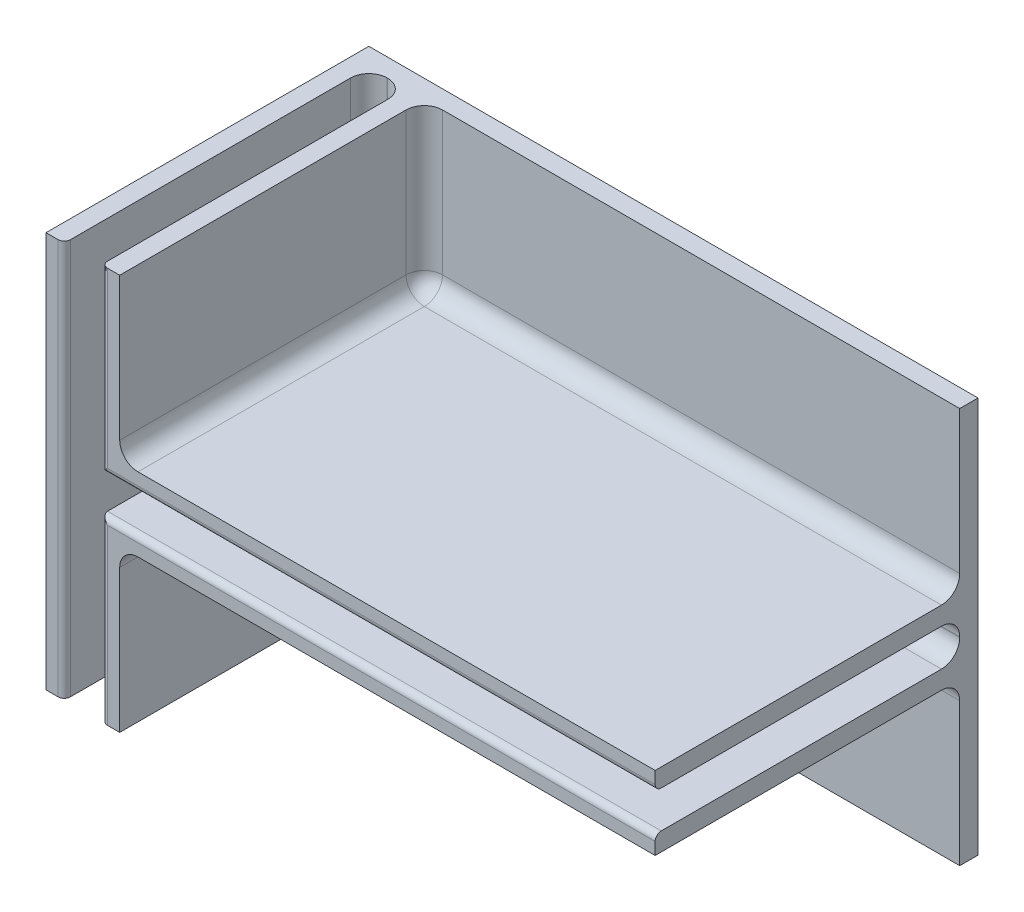
from build123d import *

# Parameters (mm, degrees)
SKETCH1_W           = 100
SKETCH1_H           = 65
BOSS_EXTRUDE1_DEPTH = 3
SKETCH2_W           = 3
SKETCH2_H           = 65
BOSS_EXTRUDE2_DEPTH = 50
FILLET2_R           = 3
FILLET3_R           = 1


with BuildPart() as part:
    # Sketch1 → Boss-Extrude1 (new body)
    with BuildSketch(Plane.XY):
        with Locations((50, 32.5)):
            Rectangle(SKETCH1_W, SKETCH1_H)
    extrude(amount=BOSS_EXTRUDE1_DEPTH)

    # Sketch2 → Boss-Extrude2 (add)
    with BuildSketch(Plane.XY.offset(3)):
        Polygon((9.1, 65), (9.1, 35.55), (100, 35.55), (100, 38.55), (12.1, 38.55), (12.1, 65), align=None)
        with Locations((1.5, 32.5)):
            Rectangle(SKETCH2_W, SKETCH2_H)
        Polygon((9.1, 0), (9.1, 29.45), (100, 29.45), (100, 26.45), (12.1, 26.45), (12.1, 0), align=None)
    extrude(amount=BOSS_EXTRUDE2_DEPTH)

    # Fillet2
    fillet2_edges = [part.edges().sort_by_distance(p)[0] for p in [
        (12.1, 26.45, 28),
        (56.05, 26.45, 3),
        (12.1, 13.225, 3),
        (12.1, 38.55, 28),
        (56.05, 38.55, 3),
        (12.1, 51.775, 3),
        (54.55, 29.45, 3),
        (54.55, 35.55, 3),
        (9.1, 50.275, 3),
        (9.1, 14.725, 3),
        (3, 32.5, 3),
    ]]
    fillet(fillet2_edges, radius=FILLET2_R)

    # Fillet3
    fillet3_edges = [part.edges().sort_by_distance(p)[0] for p in [
        (54.55, 29.45, 53),
        (54.55, 35.55, 53),
        (9.1, 50.275, 53),
        (9.1, 14.725, 53),
        (3, 32.5, 53),
    ]]
    fillet(fillet3_edges, radius=FILLET3_R)


solid = part.part
